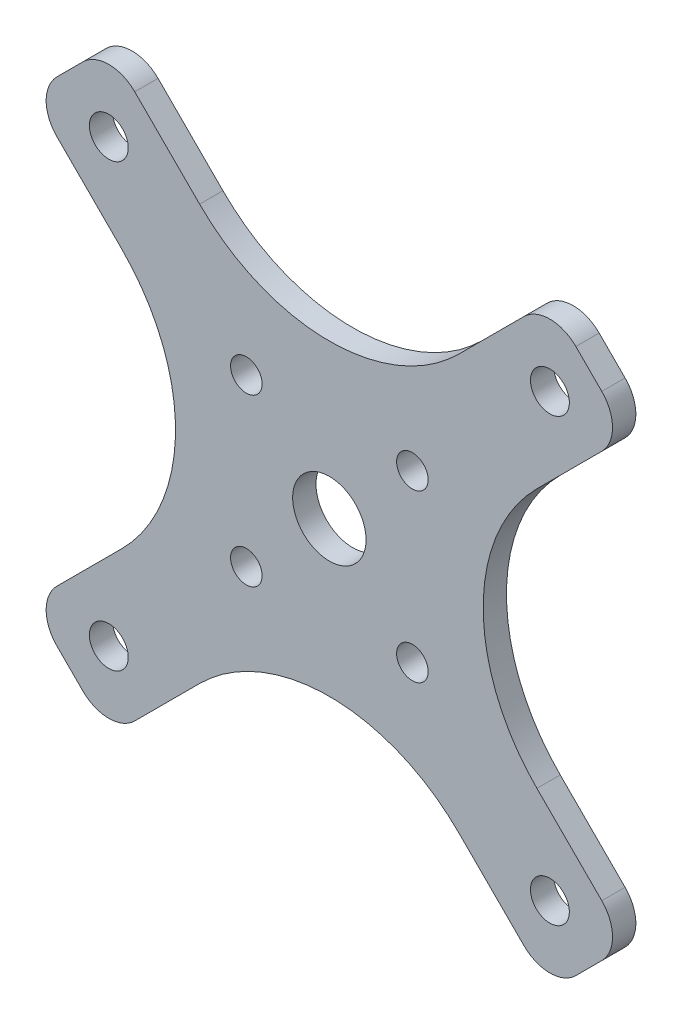
from build123d import *

# Parameters (mm, degrees)
SKETCH1_R            = 5
BOSS_EXTRUDE1_DEPTH  = 1.5875
M4_CLEARANCE_HOLE1_D = 4.3
M5_CLEARANCE_HOLE1_D = 5.3
FILLET1_R            = 25
FILLET2_R            = 5


with BuildPart() as part:
    # Sketch1 → Boss-Extrude1 (new, symmetric)
    with BuildSketch(Plane.XY):
        Polygon((0, 10.606601718), (30.0520382, 40.658639918), (40.658639918, 30.0520382), (10.606601718, 0), (40.658639918, -30.0520382), (30.0520382, -40.658639918), (0, -10.606601718), (-30.0520382, -40.658639918), (-40.658639918, -30.0520382), (-10.606601718, 0), (-40.658639918, 30.0520382), (-30.0520382, 40.658639918), align=None)
        Circle(SKETCH1_R, mode=Mode.SUBTRACT)
    extrude(amount=BOSS_EXTRUDE1_DEPTH, both=True)

    # M4 Clearance Hole1 (through all)
    with Locations(Plane.XY.offset(1.5875)):
        with Locations((-11.313708499, 11.313708499), (11.313708499, 11.313708499), (11.313708499, -11.313708499), (-11.313708499, -11.313708499)):
            Hole(M4_CLEARANCE_HOLE1_D / 2)

    # M5 Clearance Hole1 (through all)
    with Locations(Plane(origin=(0, 0, -1.5875), x_dir=(-1, 0, 0), z_dir=(0, 0, -1))):
        with Locations((-30.0520382, 30.0520382), (30.0520382, 30.0520382), (30.0520382, -30.0520382), (-30.0520382, -30.0520382)):
            Hole(M5_CLEARANCE_HOLE1_D / 2)

    # Fillet1
    fillet1_edges = [part.edges().sort_by_distance(p)[0] for p in [
        (-10.606601718, 0, 0),
        (0, -10.606601718, 0),
        (10.606601718, 0, 0),
        (0, 10.606601718, 0),
    ]]
    fillet(fillet1_edges, radius=FILLET1_R)

    # Fillet2
    fillet2_edges = [part.edges().sort_by_distance(p)[0] for p in [
        (40.658639918, -30.0520382, 0),
        (30.0520382, -40.658639918, 0),
        (-30.0520382, -40.658639918, 0),
        (-40.658639918, -30.0520382, 0),
        (-40.658639918, 30.0520382, 0),
        (-30.0520382, 40.658639918, 0),
        (30.0520382, 40.658639918, 0),
        (40.658639918, 30.0520382, 0),
    ]]
    fillet(fillet2_edges, radius=FILLET2_R)


solid = part.part
